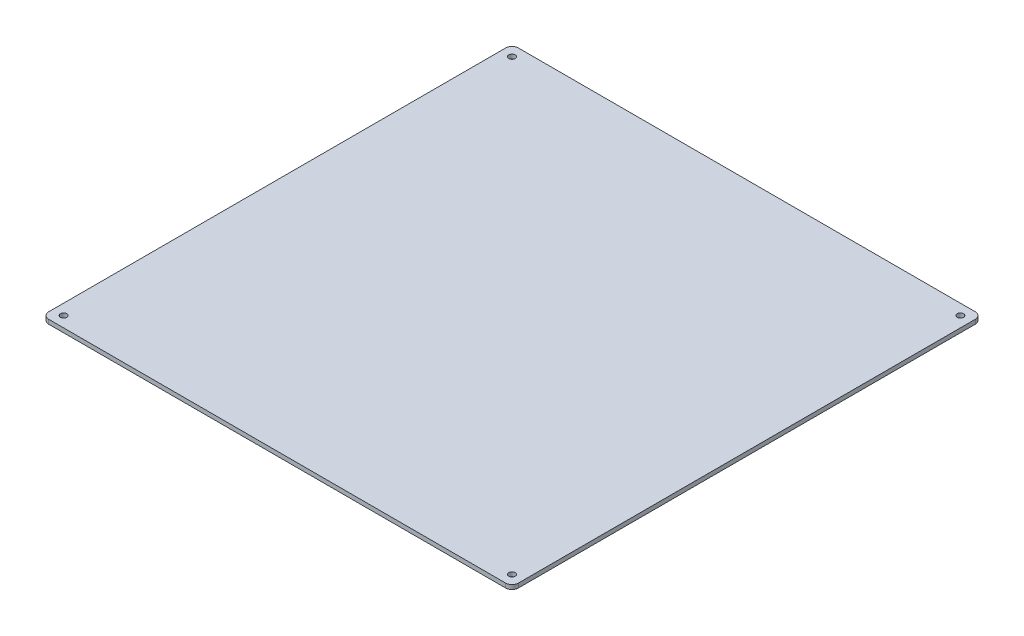
from build123d import *

# Parameters (mm, degrees)
SKETCH_1_W      = 219
SKETCH_1_H      = 219
SKETCH_1_R      = 1.5
EXTRUDE_1_DEPTH = 2
FILLET_1_R      = 3


with BuildPart() as part:
    # 스케치1 → 보스-돌출1 (new body)
    with BuildSketch(Plane(origin=(0, 0, 0), x_dir=(1, 0, 0), z_dir=(0, 1, 0))):
        Rectangle(SKETCH_1_W, SKETCH_1_H)
        with Locations((-104.5, 104.5)):
            Circle(SKETCH_1_R, mode=Mode.SUBTRACT)
        with Locations((-104.5, -104.5)):
            Circle(SKETCH_1_R, mode=Mode.SUBTRACT)
        with Locations((104.5, -104.5)):
            Circle(SKETCH_1_R, mode=Mode.SUBTRACT)
        with Locations((104.5, 104.5)):
            Circle(SKETCH_1_R, mode=Mode.SUBTRACT)
    extrude(amount=EXTRUDE_1_DEPTH)

    # 필렛1
    fillet_1_edges = [part.edges().sort_by_distance(p)[0] for p in [
        (-109.5, 1, -109.5),
        (109.5, 1, -109.5),
        (-109.5, 1, 109.5),
        (109.5, 1, 109.5),
    ]]
    fillet(fillet_1_edges, radius=FILLET_1_R)


solid = part.part
